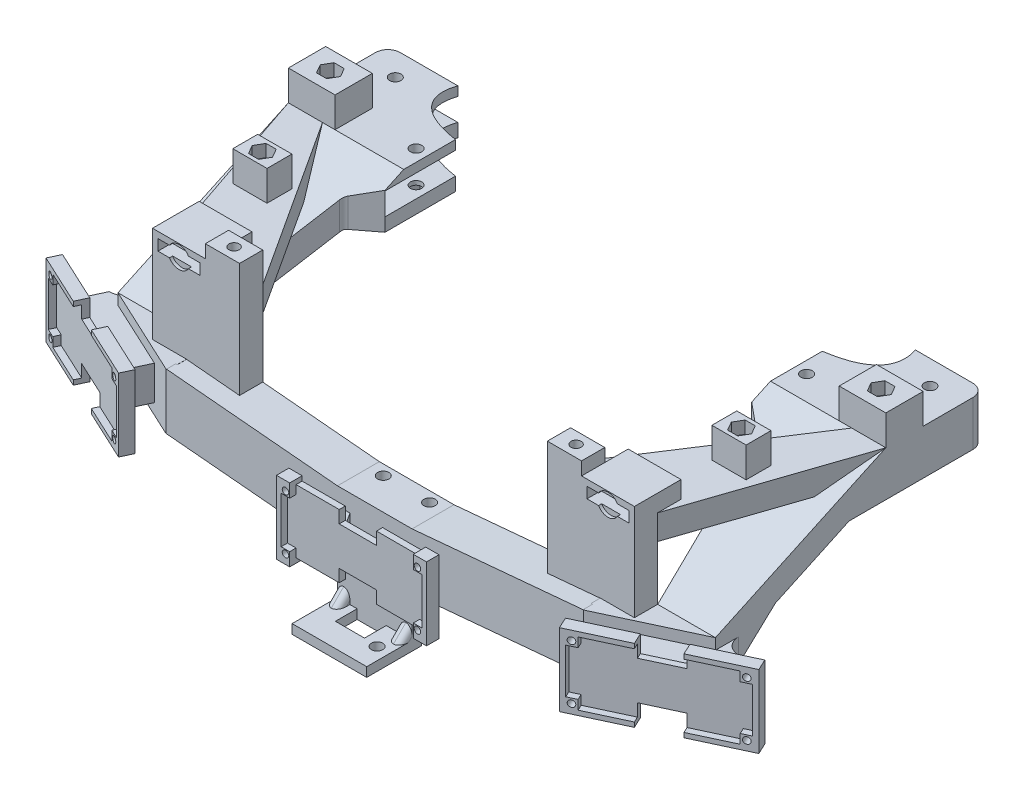
from build123d import *
from build123d.topology import SkipClean

# Parameters (mm, degrees)
CROQUIS1_W               = 24
CROQUIS1_H               = 13.47
CROQUIS1_R               = 1.825
SALIENTE_EXTRUIR1_DEPTH  = 3
CROQUIS2_W               = 24
CROQUIS2_H               = 3
SALIENTE_EXTRUIR2_DEPTH  = 11.08
CROQUIS5_W               = 4
CROQUIS5_H               = 6
SALIENTE_EXTRUIR3_DEPTH  = 3.5
CROQUIS6_W               = 45.25
CROQUIS6_H               = 20.4
SALIENTE_EXTRUIR4_DEPTH  = 4
CROQUIS7_W               = 12
CROQUIS7_H               = 4
CORTAR_EXTRUIR1_DEPTH    = 4
CORTAR_EXTRUIR3_DEPTH    = 2.05
CROQUIS9_R               = 1.05
CORTAR_EXTRUIR4_DEPTH    = 4
CROQUIS10_W              = 24
CROQUIS10_H              = 3
SALIENTE_EXTRUIR5_DEPTH  = 20
CROQUIS11_W              = 24
CROQUIS11_H              = 3
SALIENTE_EXTRUIR6_DEPTH  = 20
CROQUIS12_W              = 4
CROQUIS12_H              = 4
SALIENTE_EXTRUIR7_DEPTH  = 4
CORTAR_EXTRUIR5_DEPTH    = 51.644417511
CROQUIS14_W              = 4
CROQUIS14_H              = 4
SALIENTE_EXTRUIR8_DEPTH  = 4
CORTAR_EXTRUIR6_DEPTH    = 48.998510654
REDONDEO3_R              = 2
REDONDEO4_R              = 2
CROQUIS17_W              = 4
CROQUIS17_H              = 2.5
SALIENTE_EXTRUIR9_DEPTH  = 1.3
CROQUIS19_W              = 4
CROQUIS19_H              = 2.5
SALIENTE_EXTRUIR10_DEPTH = 1.3
CORTAR_EXTRUIR7_START    = -24
CORTAR_EXTRUIR7_DEPTH    = 24
CROQUIS22_W              = 11.36
CROQUIS22_H              = 7
CORTAR_EXTRUIR9_DEPTH    = 3
CROQUIS23_W              = 22.678246381
CROQUIS23_H              = 33.47
CORTAR_EXTRUIR10_DEPTH   = 53.538909629
SALIENTE_EXTRUIR11_DEPTH = 3
CROQUIS28_W              = 3
CROQUIS28_H              = 18
SALIENTE_EXTRUIR12_DEPTH = 0.2
SALIENTE_EXTRUIR13_DEPTH = 18
SALIENTE_EXTRUIR20_DEPTH = 18
SALIENTE_EXTRUIR45_DEPTH = 18
CORTAR_EXTRUIR41_START   = 5
CROQUIS116_W             = 95.983850417
CROQUIS116_H             = 5.547821778
CORTAR_EXTRUIR41_DEPTH   = 132.323278776
SALIENTE_EXTRUIR46_DEPTH = 29.551592
CHAFL_N9_SIZE2           = 21.238686114
CHAFL_N9_SIZE            = 9
CROQUIS62_W              = 32
CROQUIS62_H              = 18
SALIENTE_EXTRUIR25_DEPTH = 45
CROQUIS63_W              = 32
CROQUIS63_H              = 3.5
CORTAR_EXTRUIR17_DEPTH   = 119.477489094
CROQUIS126_W             = 32
CROQUIS126_H             = 7.2
CORTAR_EXTRUIR44_DEPTH   = 39.91
SALIENTE_EXTRUIR47_REACH = 145.527
CROQUIS127_W             = 45
CROQUIS127_H             = 11.5
SALIENTE_EXTRUIR26_DEPTH = 3
CROQUIS31_W              = 30
CROQUIS31_H              = 11
SALIENTE_EXTRUIR14_DEPTH = 8
REDONDEO12_R             = 5
SALIENTE_EXTRUIR49_DEPTH = 15.448407793
CROQUIS128_W             = 45.25
CROQUIS128_H             = 20.4
SALIENTE_EXTRUIR48_DEPTH = 4
CROQUIS129_W             = 12
CROQUIS129_H             = 4
CORTAR_EXTRUIR45_DEPTH   = 4
CORTAR_EXTRUIR46_DEPTH   = 2.05
CROQUIS131_R             = 1.05
CORTAR_EXTRUIR47_DEPTH   = 4
SALIENTE_EXTRUIR34_DEPTH = 4
SALIENTE_EXTRUIR50_DEPTH = 4
SALIENTE_EXTRUIR41_DEPTH = 7.47
CORTAR_EXTRUIR55_DEPTH   = 174.973220464
SALIENTE_EXTRUIR56_DEPTH = 8
CROQUIS105_W             = 17
CROQUIS105_H             = 15
SALIENTE_EXTRUIR42_DEPTH = 5.5
CROQUIS106_W             = 13.5
CROQUIS106_H             = 3.5
CORTAR_EXTRUIR34_DEPTH   = 15
CROQUIS107_R             = 3.5
CORTAR_EXTRUIR48_DEPTH   = 1
CROQUIS108_W             = 11
CROQUIS108_H             = 7.47
CROQUIS108_R             = 1.65
SALIENTE_EXTRUIR43_DEPTH = 9.7
CROQUIS109_R             = 1.65
CORTAR_EXTRUIR36_DEPTH   = 178.802203132
CROQUIS55_R              = 1.825
CORTAR_EXTRUIR15_DEPTH   = 3
CROQUIS56_W              = 2
CROQUIS56_H              = 7
SALIENTE_EXTRUIR22_DEPTH = 3
CROQUIS57_W              = 24
CROQUIS57_H              = 7.85
SALIENTE_EXTRUIR23_DEPTH = 8.22
CORTAR_EXTRUIR16_START   = -7.85
CROQUIS58_R              = 1.825
CORTAR_EXTRUIR16_DEPTH   = 7.85
CROQUIS80_W              = 5.4
CROQUIS80_H              = 3
CORTAR_EXTRUIR26_DEPTH   = 168.219451736
SALIENTE_EXTRUIR54_DEPTH = 18.581508219
CROQUIS140_W             = 39.91
CROQUIS140_H             = 7.2
CORTAR_EXTRUIR49_DEPTH   = 6
CROQUIS143_R             = 1.825
CORTAR_EXTRUIR50_DEPTH   = 170.12750054
CORTAR_EXTRUIR51_DEPTH   = 174.973220464
REDONDEO13_R             = 4
REDONDEO15_R             = 3
CROQUIS145_W             = 15
CROQUIS145_H             = 12
CROQUIS145_W_2           = 11
CROQUIS145_H_2           = 8
SALIENTE_EXTRUIR55_DEPTH = 9.7
CROQUIS146_R             = 1.825
CORTAR_EXTRUIR52_DEPTH   = 178.802203189
CORTAR_EXTRUIR53_DEPTH   = 4
CORTAR_EXTRUIR54_DEPTH   = 3
CROQUIS152_W             = 7.896983562
CROQUIS152_H             = 43.172273717
CORTAR_EXTRUIR56_DEPTH   = 174.973220522


# Some blends are built 0.0001 mm under size
with BuildPart() as part:
    # Croquis1 → Saliente-Extruir1 (new body)
    with BuildSketch(Plane(origin=(0, 0, 0), x_dir=(1, 0, 0), z_dir=(0, 1, 0))):
        with Locations((12, 6.735)):
            Rectangle(CROQUIS1_W, CROQUIS1_H)
        with Locations(Location((4.55, 10.175, 0), (0, 0, 270))):
            Circle(CROQUIS1_R, mode=Mode.SUBTRACT)
        with Locations(Location((19.45, 10.175, 0), (0, 0, 270))):
            Circle(CROQUIS1_R, mode=Mode.SUBTRACT)
    extrude(amount=SALIENTE_EXTRUIR1_DEPTH)

    # Croquis2 → Saliente-Extruir2 (add)
    with BuildSketch(Plane.XZ):
        with Locations((12, -1.5)):
            Rectangle(CROQUIS2_W, CROQUIS2_H)
    extrude(amount=SALIENTE_EXTRUIR2_DEPTH)

    # Croquis5 → Saliente-Extruir3 (add)
    with BuildSketch(Plane.XY):
        with Locations((22, -8.08)):
            Rectangle(CROQUIS5_W, CROQUIS5_H)
        with Locations((2, -8.08)):
            Rectangle(CROQUIS5_W, CROQUIS5_H)
    extrude(amount=SALIENTE_EXTRUIR3_DEPTH)

    # Croquis6 → Saliente-Extruir4 (add)
    with BuildSketch(Plane.XY.offset(3.5)):
        with Locations((12, -8.08)):
            Rectangle(CROQUIS6_W, CROQUIS6_H)
    extrude(amount=SALIENTE_EXTRUIR4_DEPTH)

    # Croquis7 → Cortar-Extruir1 (cut)
    with BuildSketch(Plane.XY.offset(7.5)):
        with Locations((12, -16.28)):
            Rectangle(CROQUIS7_W, CROQUIS7_H)
        with Locations((12, 0.12)):
            Rectangle(CROQUIS7_W, CROQUIS7_H)
    extrude(amount=-CORTAR_EXTRUIR1_DEPTH, mode=Mode.SUBTRACT)

    # Croquis8 → Cortar-Extruir3 (cut)
    with BuildSketch(Plane.XY.offset(7.5)):
        Polygon((18, -18.28), (31.875, -18.28), (31.875, -15.53), (34.625, -15.53), (34.625, -0.63), (31.875, -0.63), (31.875, 2.12), (-7.875, 2.12), (-7.875, -0.63), (-10.625, -0.63), (-10.625, -15.53), (-7.875, -15.53), (-7.875, -18.28), (6, -18.28), (6, -14.28), (18, -14.28), align=None)
    extrude(amount=-CORTAR_EXTRUIR3_DEPTH, mode=Mode.SUBTRACT)

    # Croquis9 → Cortar-Extruir4 (cut)
    with BuildSketch(Plane.XY.offset(7.5)):
        with Locations((33.225, 0.68)):
            Circle(CROQUIS9_R)
        with Locations((-9.225, 0.68)):
            Circle(CROQUIS9_R)
        with Locations((33.225, -16.84)):
            Circle(CROQUIS9_R)
        with Locations((-9.225, -16.84)):
            Circle(CROQUIS9_R)
    extrude(amount=-CORTAR_EXTRUIR4_DEPTH, mode=Mode.SUBTRACT)

    # Croquis10 → Saliente-Extruir5 (add)
    with BuildSketch(Plane.XZ.offset(11.08)):
        with Locations((12, -1.5)):
            Rectangle(CROQUIS10_W, CROQUIS10_H)
    extrude(amount=SALIENTE_EXTRUIR5_DEPTH)

    # Croquis11 → Saliente-Extruir6 (add)
    with BuildSketch(Plane.XY):
        with Locations((12, -29.58)):
            Rectangle(CROQUIS11_W, CROQUIS11_H)
    extrude(amount=SALIENTE_EXTRUIR6_DEPTH)

    # Croquis12 → Saliente-Extruir7 (add)
    with BuildSketch(Plane.XY):
        with Locations((22, -26.08)):
            Rectangle(CROQUIS12_W, CROQUIS12_H)
        with Locations((2, -26.08)):
            Rectangle(CROQUIS12_W, CROQUIS12_H)
    extrude(amount=SALIENTE_EXTRUIR7_DEPTH)

    # Croquis13 → Cortar-Extruir5 (cut, through all)
    with BuildSketch(Plane.ZY):
        Polygon((4, -28.08), (4, -24.08), (0, -24.08), align=None)
    extrude(amount=-CORTAR_EXTRUIR5_DEPTH, mode=Mode.SUBTRACT)

    # Croquis14 → Saliente-Extruir8 (add)
    with BuildSketch(Plane(origin=(0, 0, -3), x_dir=(-1, 0, 0), z_dir=(0, 0, -1))):
        with Locations((-6, -2)):
            Rectangle(CROQUIS14_W, CROQUIS14_H)
        with Locations((-18, -2)):
            Rectangle(CROQUIS14_W, CROQUIS14_H)
    extrude(amount=SALIENTE_EXTRUIR8_DEPTH)

    # Croquis15 → Cortar-Extruir6 (cut, through all)
    with BuildSketch(Plane(origin=(20, 0, 0), x_dir=(0, 0, -1), z_dir=(1, 0, 0))):
        Polygon((3, -4), (7, 0), (7, -4), align=None)
    extrude(amount=-CORTAR_EXTRUIR6_DEPTH, mode=Mode.SUBTRACT)

    # Redondeo3
    redondeo3_edges = [part.edges().sort_by_distance(p)[0] for p in [
        (20, -2, -5),
        (4, -2, -5),
        (8, -2, -5),
        (16, -2, -5),
    ]]
    fillet(redondeo3_edges, radius=REDONDEO3_R - 0.0001)  # a hair under: the kernel refuses the full size

    # Redondeo4
    redondeo4_edges = [part.edges().sort_by_distance(p)[0] for p in [
        (24, -26.08, 2),
        (20, -26.08, 2),
        (4, -26.08, 2),
        (0, -26.08, 2),
    ]]
    fillet(redondeo4_edges, radius=REDONDEO4_R - 0.0001)  # a hair under: the kernel refuses the full size

    # Croquis17 → Saliente-Extruir9 (add)
    with BuildSketch(Plane(origin=(0, 0, 3.5), x_dir=(-1, 0, 0), z_dir=(0, 0, -1))):
        with Locations((-22, -3.83)):
            Rectangle(CROQUIS17_W, CROQUIS17_H)
        with Locations((-2, -3.83)):
            Rectangle(CROQUIS17_W, CROQUIS17_H)
        with Locations((-22, -12.33)):
            Rectangle(CROQUIS17_W, CROQUIS17_H)
        with Locations((-2, -12.33)):
            Rectangle(CROQUIS17_W, CROQUIS17_H)
    extrude(amount=SALIENTE_EXTRUIR9_DEPTH)

    # Croquis19 → Saliente-Extruir10 (add)
    with BuildSketch(Plane.XY):
        with Locations((22, -3.83)):
            Rectangle(CROQUIS19_W, CROQUIS19_H)
        with Locations((2, -3.83)):
            Rectangle(CROQUIS19_W, CROQUIS19_H)
        with Locations((22, -12.33)):
            Rectangle(CROQUIS19_W, CROQUIS19_H)
        with Locations((2, -12.33)):
            Rectangle(CROQUIS19_W, CROQUIS19_H)
    extrude(amount=SALIENTE_EXTRUIR10_DEPTH)

    # Croquis20 → Cortar-Extruir7 (cut)
    with BuildSketch(Plane(origin=(24, 0, 0), x_dir=(0, 0, -1), z_dir=(1, 0, 0)).offset(CORTAR_EXTRUIR7_START)):
        Polygon((-2.2, -5.08), (-2.2, -2.58), (-3.5, -2.58), align=None)
        Polygon((-1.3, -2.58), (0, -2.58), (-1.3, -5.08), align=None)
        Polygon((-1.3, -11.08), (-1.3, -13.58), (0, -13.58), align=None)
        Polygon((-2.2, -13.58), (-3.5, -13.58), (-2.2, -11.08), align=None)
    extrude(amount=CORTAR_EXTRUIR7_DEPTH, mode=Mode.SUBTRACT)

    # Croquis22 → Cortar-Extruir9 (cut)
    with BuildSketch(Plane(origin=(0, -28.08, 0), x_dir=(1, 0, 0), z_dir=(0, 1, 0))):
        with Locations((12, -3.5)):
            Rectangle(CROQUIS22_W, CROQUIS22_H)
    extrude(amount=-CORTAR_EXTRUIR9_DEPTH, mode=Mode.SUBTRACT)

    # Croquis23 → Cortar-Extruir10 (cut, through all)
    with BuildSketch(Plane(origin=(0, 3, 0), x_dir=(1, 0, 0), z_dir=(0, 1, 0))):
        with Locations((0.660876809, -3.265)):
            Rectangle(CROQUIS23_W, CROQUIS23_H)
    extrude(amount=-CORTAR_EXTRUIR10_DEPTH, mode=Mode.SUBTRACT)

    # Croquis25 → Saliente-Extruir11 (add)
    with BuildSketch(Plane.XY):
        Polygon((24, 3), (79, 8), (79, -10), (24, -15), align=None)
    extrude(amount=-SALIENTE_EXTRUIR11_DEPTH)

    # Croquis28 → Saliente-Extruir12 (add)
    with BuildSketch(Plane(origin=(79, 0, 0), x_dir=(0, 0, -1), z_dir=(1, 0, 0))):
        with Locations((1.5, -1)):
            Rectangle(CROQUIS28_W, CROQUIS28_H)
    extrude(amount=SALIENTE_EXTRUIR12_DEPTH)

    # Croquis29 → Saliente-Extruir13 (add)
    with BuildSketch(Plane(origin=(0, 8, 0), x_dir=(1, 0, 0), z_dir=(0, 1, 0))):
        Polygon((79.2, 3), (113.550329655, 19.017821778), (119.983850417, 19.017821778), (79.2, 0), align=None)
    extrude(amount=-SALIENTE_EXTRUIR13_DEPTH)

    # Croquis43 → Saliente-Extruir20 (add)
    with BuildSketch(Plane(origin=(0, 8, 0), x_dir=(1, 0, 0), z_dir=(0, 1, 0))):
        Polygon((113.550329655, 19.017821778), (112.885245667, 19.017821778), (78.534916012, 3), (79.2, 3), align=None)
    extrude(amount=-SALIENTE_EXTRUIR20_DEPTH)

    # Croquis115 → Saliente-Extruir45 (add)
    with BuildSketch(Plane(origin=(0, 8, 0), x_dir=(1, 0, 0), z_dir=(0, 1, 0))):
        Polygon((112.885245667, 19.017821778), (78.534916012, 19.017821778), (78.534916012, 3), align=None)
    extrude(amount=-SALIENTE_EXTRUIR45_DEPTH)

    # Croquis116 → Cortar-Extruir41 (cut, through all)
    with BuildSketch(Plane(origin=(0, 3, 0), x_dir=(1, 0, 0), z_dir=(0, 1, 0)).offset(CORTAR_EXTRUIR41_START)):
        with Locations((71.991925209, 16.243910889)):
            Rectangle(CROQUIS116_W, CROQUIS116_H)
    extrude(amount=-CORTAR_EXTRUIR41_DEPTH, mode=Mode.SUBTRACT)

    # Croquis118 → Saliente-Extruir46 (add)
    with BuildSketch(Plane.ZY.offset(-78.534916012)):
        Polygon((-13.47, -1), (-68.29, 24.5), (-68.29, 33.5), (-13.47, 8), align=None)
    extrude(amount=-SALIENTE_EXTRUIR46_DEPTH)

    # Chaflán9
    chafl_n9_edges = [part.edges().sort_by_distance(p)[0] for p in [
        (93.310712012, -1, -13.47),
    ]]
    chafl_n9_side = [part.faces().sort_by_distance(p)[0] for p in [
        (93.310712012, -1.18, -13.47),
    ]]
    chamfer(chafl_n9_edges, length=CHAFL_N9_SIZE - 0.0001, length2=CHAFL_N9_SIZE2 - 0.0001, reference=chafl_n9_side[0])  # a hair under: the kernel refuses the full size

    # Croquis62 → Saliente-Extruir25 (add)
    with BuildSketch(Plane.ZY.offset(-108.086508219)):
        with Locations((-84.29, 28)):
            Rectangle(CROQUIS62_W, CROQUIS62_H)
    extrude(amount=SALIENTE_EXTRUIR25_DEPTH)

    # Croquis63 → Cortar-Extruir17 (cut, through all)
    with BuildSketch(Plane.ZY.offset(-63.086508219)):
        with Locations((-84.29, 35.25)):
            Rectangle(CROQUIS63_W, CROQUIS63_H)
    extrude(amount=-CORTAR_EXTRUIR17_DEPTH, mode=Mode.SUBTRACT)

    # Croquis126 → Cortar-Extruir44 (cut)
    with BuildSketch(Plane.ZY.offset(-63.086508219)):
        with Locations((-84.29, 26.9)):
            Rectangle(CROQUIS126_W, CROQUIS126_H)
    extrude(amount=-CORTAR_EXTRUIR44_DEPTH, mode=Mode.SUBTRACT)

    # Saliente-Extruir47: up to this face of the body (flat: up to its plane)
    saliente_extruir47_end = Plane(part.part.faces().sort_by_distance((93.310712012, 16.228818236, -50.508581008))[0])
    # Croquis127 → Saliente-Extruir47 (add, up to the picked face)
    with BuildSketch(Plane.XY.offset(-68.29), mode=Mode.PRIVATE) as saliente_extruir47_sk1:
        with Locations((85.586508219, 24.75)):
            Rectangle(CROQUIS127_W, CROQUIS127_H)
    saliente_extruir47_tool1 = split(extrude(saliente_extruir47_sk1.sketch, amount=SALIENTE_EXTRUIR47_REACH, mode=Mode.PRIVATE), bisect_by=saliente_extruir47_end, keep=Keep.BOTH, mode=Mode.PRIVATE)
    add(saliente_extruir47_tool1.solids().sort_by(Axis((85.586508, 24.75, -68.29), (0, 0, 1)))[0])

    # Croquis66 → Saliente-Extruir26 (add)
    with BuildSketch(Plane(origin=(0, 0, -3), x_dir=(-1, 0, 0), z_dir=(0, 0, -1))):
        Polygon((-24, 0), (-34.625, -14.034090909), (-78.534916012, -10.042280363), (-78.534916012, 7.957719637), (-24, 3), align=None)
    extrude(amount=SALIENTE_EXTRUIR26_DEPTH)

    # Croquis31 → Saliente-Extruir14 (add)
    with BuildSketch(Plane(origin=(14.145610656, 0, 30.335359948), x_dir=(0.9063077870366493, 0, -0.42261826174070105), z_dir=(0.42261826174070105, 0, 0.9063077870366493))):
        with Locations((94.404576733, -1)):
            Rectangle(CROQUIS31_W, CROQUIS31_H)
    extrude(amount=SALIENTE_EXTRUIR14_DEPTH)

    # Redondeo12
    # the kernel refuses this fillet: 5 mm, written as the material it adds along each edge
    with BuildSketch(Plane(origin=(108.086508012, -25.066148444, -13.469999903), x_dir=(0, 0, -1), z_dir=(-5.2924098620788986e-09, 1.0, 0))) as redondeo12_piece_1_section:
        with BuildLine():
            CenterArc((7.426459474, -5), REDONDEO12_R, 90, 92.445237711)
            Line((2.431012195, -5.213322475), (0, 0))
            Line((0, 0), (7.426459474, 0))
        make_face()
    redondeo12_piece_1 = extrude(amount=29.566148444, mode=Mode.PRIVATE)
    redondeo12_piece_1 = split(redondeo12_piece_1, bisect_by=Plane(origin=(111.36161695, -7.305259893, -16.359657008), z_dir=(0, 0.7313547931900813, 0.6819971894941308)), keep=Keep.TOP, mode=Mode.PRIVATE)
    add(redondeo12_piece_1)

    # Croquis132 → Saliente-Extruir49 (add)
    with BuildSketch(Plane.ZY.offset(-78.534916012)):
        Polygon((-68.29, 24.5), (-68.29, 33.5), (-56.48505408, 28.008826688), (-56.466078431, 19), align=None)
    extrude(amount=SALIENTE_EXTRUIR49_DEPTH)

    # Croquis128 → Saliente-Extruir48 (add)
    with BuildSketch(Plane(origin=(17.52655675, 0, 37.585822244), x_dir=(0.9063077870366492, 0, -0.42261826174070116), z_dir=(0.42261826174070116, 0, 0.9063077870366492))):
        with Locations((94.404576733, -1)):
            Rectangle(CROQUIS128_W, CROQUIS128_H)
    extrude(amount=SALIENTE_EXTRUIR48_DEPTH)

    # Croquis129 → Cortar-Extruir45 (cut)
    with BuildSketch(Plane(origin=(19.217029797, 0, 41.211053392), x_dir=(0.906307787036649, 0, -0.4226182617407014), z_dir=(0.4226182617407014, 0, 0.906307787036649))):
        with Locations((94.404576733, 7.2)):
            Rectangle(CROQUIS129_W, CROQUIS129_H)
        with Locations((94.404576733, -9.2)):
            Rectangle(CROQUIS129_W, CROQUIS129_H)
    extrude(amount=-CORTAR_EXTRUIR45_DEPTH, mode=Mode.SUBTRACT)

    # Croquis130 → Cortar-Extruir46 (cut)
    with BuildSketch(Plane(origin=(19.217029797, 0, 41.211053392), x_dir=(0.906307787036649, 0, -0.4226182617407014), z_dir=(0.4226182617407014, 0, 0.906307787036649))):
        Polygon((88.404576733, 9.2), (74.779576733, 9.2), (74.779576733, 6.2), (71.779576733, 6.2), (71.779576733, -8.2), (74.779576733, -8.2), (74.779576733, -11.2), (88.404576733, -11.2), (88.404576733, -7.2), (100.404576733, -7.2), (100.404576733, -11.2), (114.029576733, -11.2), (114.029576733, -8.2), (117.029576733, -8.2), (117.029576733, 6.2), (114.029576733, 6.2), (114.029576733, 9.2), (100.404576733, 9.2), (100.404576733, 5.2), (88.404576733, 5.2), align=None)
    extrude(amount=-CORTAR_EXTRUIR46_DEPTH, mode=Mode.SUBTRACT)

    # Croquis131 → Cortar-Extruir47 (cut)
    with BuildSketch(Plane(origin=(19.217029797, 0, 41.211053392), x_dir=(0.906307787036649, 0, -0.4226182617407014), z_dir=(0.4226182617407014, 0, 0.906307787036649))):
        with Locations((115.629576733, 7.76)):
            Circle(CROQUIS131_R)
        with Locations((115.629576733, -9.76)):
            Circle(CROQUIS131_R)
        with Locations((73.179576733, 7.76)):
            Circle(CROQUIS131_R)
        with Locations((73.179576733, -9.76)):
            Circle(CROQUIS131_R)
    extrude(amount=-CORTAR_EXTRUIR47_DEPTH, mode=Mode.SUBTRACT)

    # Croquis82 → Saliente-Extruir34 (add)
    with BuildSketch(Plane.XY.offset(7.5)):
        Polygon((31.875, 2.12), (31.875, 3.62), (36.125, 3.62), (36.125, -19.78), (31.875, -19.78), (31.875, -18.28), (34.625, -18.28), (34.625, 2.12), align=None)
    extrude(amount=-SALIENTE_EXTRUIR34_DEPTH)

    # Croquis133 → Saliente-Extruir50 (add)
    with BuildSketch(Plane(origin=(19.217029797, 0, 41.211053392), x_dir=(0.906307787036649, 0, -0.4226182617407014), z_dir=(0.4226182617407014, 0, 0.906307787036649))):
        Polygon((100.404576733, 9.2), (100.404576733, 10.7), (118.529576733, 10.7), (118.529576733, -12.7), (100.404576733, -12.7), (100.404576733, -11.2), (117.029576733, -11.2), (117.029576733, 9.2), align=None)
        Polygon((71.779576733, -11.2), (71.779576733, 9.2), (88.404576733, 9.2), (88.404576733, 10.7), (70.279576733, 10.7), (70.279576733, -12.7), (88.404576733, -12.7), (88.404576733, -11.2), align=None)
    extrude(amount=-SALIENTE_EXTRUIR50_DEPTH)

    # Croquis104 → Saliente-Extruir41 (add)
    with BuildSketch(Plane(origin=(0, 0, -6), x_dir=(-1, 0, 0), z_dir=(0, 0, -1))):
        Polygon((-89.505, 33.5), (-89.505, -9.045), (-34.625, -14.034090909), (-24, 0), (-24, 3), (-61.505, 6.409545455), (-61.505, 33.5), align=None)
    extrude(amount=SALIENTE_EXTRUIR41_DEPTH)

    # Croquis151 → Cortar-Extruir55 (cut, through all)
    with BuildSketch(Plane(origin=(0, 33.5, 0), x_dir=(1, 0, 0), z_dir=(0, 1, 0))):
        Polygon((63.086508219, 68.29), (78.534916012, 56.48505408), (89.505, 13.47), (61.505, 13.47), align=None)
    extrude(amount=-CORTAR_EXTRUIR55_DEPTH, mode=Mode.SUBTRACT)

    # Croquis150 → Saliente-Extruir56 (add)
    with BuildSketch(Plane(origin=(0, 33.5, 0), x_dir=(1, 0, 0), z_dir=(0, 1, 0))):
        Polygon((61.505, 13.47), (97.1088641, 68.29), (108.086508219, 68.29), (89.505, 13.47), align=None)
    extrude(amount=-SALIENTE_EXTRUIR56_DEPTH)

    # Croquis105 → Saliente-Extruir42 (add)
    with BuildSketch(Plane(origin=(0, 33.5, 0), x_dir=(1, 0, 0), z_dir=(0, 1, 0))):
        with Locations((81.005, 13.5)):
            Rectangle(CROQUIS105_W, CROQUIS105_H)
    extrude(amount=SALIENTE_EXTRUIR42_DEPTH)

    # Croquis106 → Cortar-Extruir34 (cut)
    with BuildSketch(Plane.XY.offset(-6)):
        with Locations((81.005, 35.25)):
            Rectangle(CROQUIS106_W, CROQUIS106_H)
    extrude(amount=-CORTAR_EXTRUIR34_DEPTH, mode=Mode.SUBTRACT)

    # Croquis107 → Cortar-Extruir48 (cut)
    with BuildSketch(Plane.XY.offset(-6)):
        with Locations((81.005, 35.25)):
            Circle(CROQUIS107_R)
    extrude(amount=-CORTAR_EXTRUIR48_DEPTH, mode=Mode.SUBTRACT)

    # Croquis108 → Saliente-Extruir43 (add)
    with BuildSketch(Plane(origin=(0, 33.5, 0), x_dir=(1, 0, 0), z_dir=(0, 1, 0))):
        with Locations((67.005, 9.735)):
            Rectangle(CROQUIS108_W, CROQUIS108_H)
        with Locations(Location((67.005, 9.735, 0), (0, 0, 270))):
            Circle(CROQUIS108_R, mode=Mode.SUBTRACT)
    extrude(amount=SALIENTE_EXTRUIR43_DEPTH)

    # Croquis109 → Cortar-Extruir36 (cut, through all)
    with SkipClean():  # the faces are left unmerged after this step: merging them gives an invalid solid
        with BuildSketch(Plane(origin=(0, 43.2, 0), x_dir=(1, 0, 0), z_dir=(0, 1, 0))):
            with Locations((67.005, 9.735)):
                Circle(CROQUIS109_R)
        extrude(amount=-CORTAR_EXTRUIR36_DEPTH, mode=Mode.SUBTRACT)

    # Simetría1: part across plane


with BuildPart() as part_1:
    with SkipClean():  # the faces are left unmerged after this step: merging them gives an invalid solid
        add(part.part)
        add(part.part.mirror(Plane(origin=(12, -31.08, -13.47), x_dir=(0, 0, 1), z_dir=(1, 0, 0))))

    # Croquis55 → Cortar-Extruir15 (cut)
    with SkipClean():  # the faces are left unmerged after this step: merging them gives an invalid solid
        with BuildSketch(Plane.XZ.offset(31.08)):
            with Locations(Location((20.03, 7.29, 0), (0, 0, 270))):
                Circle(CROQUIS55_R)
        extrude(amount=-CORTAR_EXTRUIR15_DEPTH, mode=Mode.SUBTRACT)

    # Croquis56 → Saliente-Extruir22 (add)
    with SkipClean():  # the faces are left unmerged after this step: merging them gives an invalid solid
        with BuildSketch(Plane(origin=(0, -28.08, 0), x_dir=(1, 0, 0), z_dir=(0, 1, 0))):
            with Locations((16.68, -3.5)):
                Rectangle(CROQUIS56_W, CROQUIS56_H)
        extrude(amount=-SALIENTE_EXTRUIR22_DEPTH)

    # Croquis57 → Saliente-Extruir23 (add)
    with SkipClean():  # the faces are left unmerged after this step: merging them gives an invalid solid
        with BuildSketch(Plane(origin=(0, 0, -3), x_dir=(-1, 0, 0), z_dir=(0, 0, -1))):
            with Locations((-12, -9.205)):
                Rectangle(CROQUIS57_W, CROQUIS57_H)
        extrude(amount=SALIENTE_EXTRUIR23_DEPTH)

    # Croquis58 → Cortar-Extruir16 (cut)
    with SkipClean():  # the faces are left unmerged after this step: merging them gives an invalid solid
        with BuildSketch(Plane(origin=(0, -5.28, 0), x_dir=(1, 0, 0), z_dir=(0, 1, 0)).offset(CORTAR_EXTRUIR16_START)):
            with Locations(Location((4.55, 10.175, 0), (0, 0, 270))):
                Circle(CROQUIS58_R)
            with Locations(Location((19.45, 10.175, 0), (0, 0, 270))):
                Circle(CROQUIS58_R)
        extrude(amount=CORTAR_EXTRUIR16_DEPTH, mode=Mode.SUBTRACT)

    # Croquis80 → Cortar-Extruir26 (cut, through all)
    with SkipClean():  # the faces are left unmerged after this step: merging them gives an invalid solid
        with BuildSketch(Plane.ZY):
            with Locations((17.3, -29.58)):
                Rectangle(CROQUIS80_W, CROQUIS80_H)
        extrude(amount=-CORTAR_EXTRUIR26_DEPTH, mode=Mode.SUBTRACT)

    # Croquis139 → Saliente-Extruir54 (add)
    with SkipClean():  # the faces are left unmerged after this step: merging them gives an invalid solid
        with BuildSketch(Plane.ZY.offset(65.505)):
            Polygon((-68.29, 33.5), (-80.29, 33.5), (-40.88, 20.75), align=None)
        extrude(amount=SALIENTE_EXTRUIR54_DEPTH)

    # Croquis140 → Cortar-Extruir49 (cut)
    with SkipClean():  # the faces are left unmerged after this step: merging them gives an invalid solid
        with BuildSketch(Plane(origin=(0, 0, -68.29), x_dir=(-1, 0, 0), z_dir=(0, 0, -1))):
            with Locations((-83.041508219, 26.9)):
                Rectangle(CROQUIS140_W, CROQUIS140_H)
            with Locations((59.041508219, 26.9)):
                Rectangle(CROQUIS140_W, CROQUIS140_H)
        extrude(amount=-CORTAR_EXTRUIR49_DEPTH, mode=Mode.SUBTRACT)

    # Croquis143 → Cortar-Extruir50 (cut, through all)
    with SkipClean():  # the faces are left unmerged after this step: merging them gives an invalid solid
        with BuildSketch(Plane.XZ.offset(-19)):
            with Locations(Location((-73.998491781, -92.59, 0), (0, 0, 270))):
                Circle(CROQUIS143_R)
            with Locations(Location((-50.808491781, -76.09, 0), (0, 0, 270))):
                Circle(CROQUIS143_R)
            with Locations(Location((97.998491781, -92.59, 0), (0, 0, 270))):
                Circle(CROQUIS143_R)
            with Locations(Location((74.808491781, -76.09, 0), (0, 0, 270))):
                Circle(CROQUIS143_R)
        extrude(amount=-CORTAR_EXTRUIR50_DEPTH, mode=Mode.SUBTRACT)

    # Croquis144 → Cortar-Extruir51 (cut, through all)
    with SkipClean():  # the faces are left unmerged after this step: merging them gives an invalid solid
        with BuildSketch(Plane(origin=(0, 33.5, 0), x_dir=(1, 0, 0), z_dir=(0, 1, 0))):
            with BuildLine():
                Line((-61.586508219, 100.29), (-39.086508219, 100.29))
                Line((-39.086508219, 100.29), (-39.086508219, 84.29))
                add(Edge.make_bspline(
                    [(-39.086508219, 84.29), (-57.644757352, 84.871406908), (-64.762219866, 90.782417593), (-61.586508219, 100.29)],
                    knots=[0, 0, 0, 0, 1, 1, 1, 1], degree=3))
            make_face()
            with BuildLine():
                Line((85.586508219, 100.29), (63.086508219, 100.29))
                Line((63.086508219, 100.29), (63.086508219, 84.29))
                add(Edge.make_bspline(
                    [(63.086508219, 84.29), (81.644757352, 84.871406908), (88.762219866, 90.782417593), (85.586508219, 100.29)],
                    knots=[0, 0, 0, 0, 1, 1, 1, 1], degree=3))
            make_face()
        extrude(amount=-CORTAR_EXTRUIR51_DEPTH, mode=Mode.SUBTRACT)

    # Redondeo13
    redondeo13_edges = [part_1.edges().sort_by_distance(p)[0] for p in [
        (-84.086508219, 26.25, -100.29),
        (108.086508219, 26.25, -100.29),
    ]]
    fillet(redondeo13_edges, radius=REDONDEO13_R)

    # Redondeo15
    redondeo15_edges = [part_1.edges().sort_by_distance(p)[0] for p in [
        (78.534916012, 23.504413344, -56.48505408),
        (-54.534916012, 23.504413344, -56.48505408),
    ]]
    fillet(redondeo15_edges, radius=REDONDEO15_R)

    # Croquis145 → Saliente-Extruir55 (add)
    with SkipClean():  # the faces are left unmerged after this step: merging them gives an invalid solid
        with BuildSketch(Plane(origin=(0, 33.5, 0), x_dir=(1, 0, 0), z_dir=(0, 1, 0))):
            with Locations((100.586508219, 74.29)):
                Rectangle(CROQUIS145_W, CROQUIS145_H)
            with Locations((-65.05134308, 40.88)):
                Rectangle(CROQUIS145_W_2, CROQUIS145_H_2)
            with Locations((-76.586508219, 74.29)):
                Rectangle(CROQUIS145_W, CROQUIS145_H)
            with Locations((89.05134308, 40.88)):
                Rectangle(CROQUIS145_W_2, CROQUIS145_H_2)
        extrude(amount=SALIENTE_EXTRUIR55_DEPTH)

    # Croquis146 → Cortar-Extruir52 (cut, through all)
    with SkipClean():  # the faces are left unmerged after this step: merging them gives an invalid solid
        with BuildSketch(Plane(origin=(0, 43.2, 0), x_dir=(1, 0, 0), z_dir=(0, 1, 0))):
            with Locations(Location((89.05134308, 40.88, 0), (0, 0, 270))):
                Circle(CROQUIS146_R)
            with Locations(Location((100.586508219, 74.29, 0), (0, 0, 270))):
                Circle(CROQUIS146_R)
            with Locations(Location((-76.586508219, 74.29, 0), (0, 0, 270))):
                Circle(CROQUIS146_R)
            with Locations(Location((-65.05134308, 40.88, 0), (0, 0, 270))):
                Circle(CROQUIS146_R)
        extrude(amount=-CORTAR_EXTRUIR52_DEPTH, mode=Mode.SUBTRACT)

    # Croquis147 → Cortar-Extruir53 (cut)
    with SkipClean():  # the faces are left unmerged after this step: merging them gives an invalid solid
        with BuildSketch(Plane(origin=(0, 43.2, 0), x_dir=(1, 0, 0), z_dir=(0, 1, 0))):
            Polygon((103.84853724, 74.29), (102.21752273, 77.115), (98.955493709, 77.115), (97.324479198, 74.29), (98.955493709, 71.465), (102.21752273, 71.465), align=None)
            Polygon((92.313372101, 40.88), (90.68235759, 43.705), (87.420328569, 43.705), (85.789314059, 40.88), (87.420328569, 38.055), (90.68235759, 38.055), align=None)
            Polygon((-78.21752273, 71.465), (-79.84853724, 74.29), (-78.21752273, 77.115), (-74.955493709, 77.115), (-73.324479198, 74.29), (-74.955493709, 71.465), align=None)
            Polygon((-66.68235759, 38.055), (-68.313372101, 40.88), (-66.68235759, 43.705), (-63.420328569, 43.705), (-61.789314059, 40.88), (-63.420328569, 38.055), align=None)
        extrude(amount=-CORTAR_EXTRUIR53_DEPTH, mode=Mode.SUBTRACT)

    # Croquis148 → Cortar-Extruir54 (cut)
    with SkipClean():  # the faces are left unmerged after this step: merging them gives an invalid solid
        with BuildSketch(Plane.XZ.offset(-19)):
            Polygon((96.36747727, -95.415), (94.73646276, -92.59), (96.36747727, -89.765), (99.629506291, -89.765), (101.260520802, -92.59), (99.629506291, -95.415), align=None)
            Polygon((-47.54646276, -76.09), (-49.17747727, -73.265), (-52.439506291, -73.265), (-54.070520802, -76.09), (-52.439506291, -78.915), (-49.17747727, -78.915), align=None)
            Polygon((-70.73646276, -92.59), (-72.36747727, -89.765), (-75.629506291, -89.765), (-77.260520802, -92.59), (-75.629506291, -95.415), (-72.36747727, -95.415), align=None)
            Polygon((73.17747727, -78.915), (71.54646276, -76.09), (73.17747727, -73.265), (76.439506291, -73.265), (78.070520802, -76.09), (76.439506291, -78.915), align=None)
        extrude(amount=-CORTAR_EXTRUIR54_DEPTH, mode=Mode.SUBTRACT)

    # Croquis152 → Cortar-Extruir56 (cut, through all)
    with SkipClean():  # the faces are left unmerged after this step: merging them gives an invalid solid
        with BuildSketch(Plane(origin=(0, 33.5, 0), x_dir=(1, 0, 0), z_dir=(0, 1, 0))):
            with Locations((67.035, 78.703863142)):
                Rectangle(CROQUIS152_W, CROQUIS152_H)
            with Locations((-43.035, 78.703863142)):
                Rectangle(CROQUIS152_W, CROQUIS152_H)
        extrude(amount=-CORTAR_EXTRUIR56_DEPTH, mode=Mode.SUBTRACT)


solid = part_1.part
